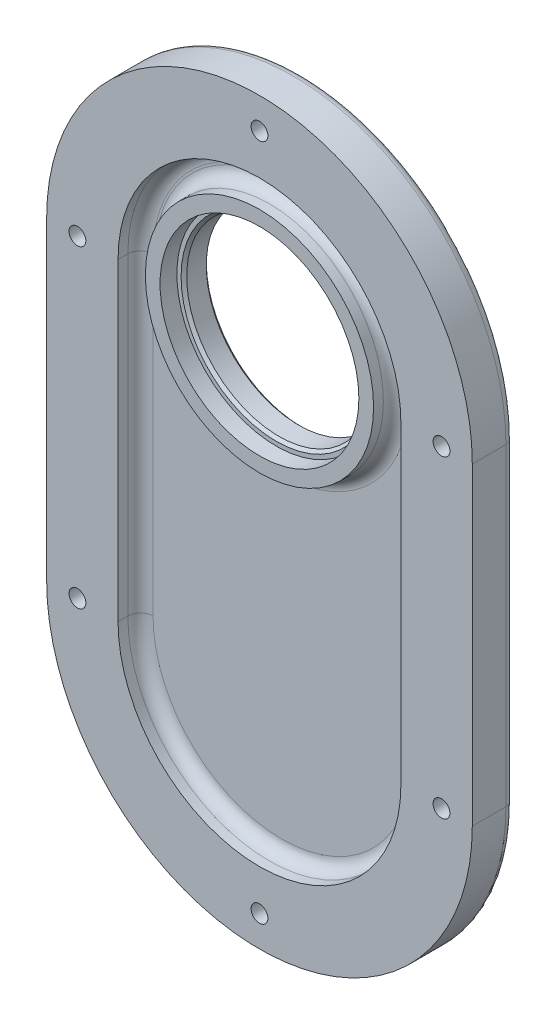
from build123d import *

# Parameters (mm, degrees)
EXTRUDE_1_DEPTH           = 15
SKETCH_2_R                = 40.75
CUT_EXTRUDE_1_DEPTH       = 8
SKETCH_3_R                = 35.5
CUT_EXTRUDE_2_DEPTH       = 6
SKETCH_4_R                = 33
CUT_EXTRUDE_3_DEPTH       = 203.98029461
CHAMFER_1_SIZE            = 1
FILLET_1_R                = 4.5
FILLET_2_R                = 3
HOLE_WIZARD_1_OUTLINE_R   = 7
HOLE_WIZARD_1_DEPTH       = 10
HOLE_START                = 10
HOLE_WIZARD_1_2_OUTLINE_R = 3
HOLE_WIZARD_1_2_DEPTH     = 5


# Read off the part's stored shape, not the designer's step: 孔1
with BuildPart() as part:
    # 草图1 → 凸台-拉伸1 (new body)
    with BuildSketch(Plane.XY):
        with BuildLine():
            Line((76, 0), (76, -112))
            ThreePointArc((76, -112), (0, -188), (-76, -112))
            Line((-76, -112), (-76, 0))
            ThreePointArc((-76, 0), (0, 76), (76, 0))
        make_face()
    extrude(amount=EXTRUDE_1_DEPTH)

    # 草图2 → 切除-拉伸1 (cut)
    with BuildSketch(Plane.XY.offset(15)):
        with BuildLine():
            Line((50.5, 0), (50.5, -112))
            ThreePointArc((50.5, -112), (0, -162.5), (-50.5, -112))
            Line((-50.5, -112), (-50.5, 0))
            ThreePointArc((-50.5, 0), (0, 50.5), (50.5, 0))
        make_face()
        Circle(SKETCH_2_R, mode=Mode.SUBTRACT)
    extrude(amount=-CUT_EXTRUDE_1_DEPTH, mode=Mode.SUBTRACT)

    # 草图3 → 切除-拉伸2 (cut)
    with BuildSketch(Plane.XY.offset(15)):
        Circle(SKETCH_3_R)
    extrude(amount=-CUT_EXTRUDE_2_DEPTH, mode=Mode.SUBTRACT)

    # 草图4 → 切除-拉伸3 (cut, through all)
    with BuildSketch(Plane.XY.offset(9)):
        Circle(SKETCH_4_R)
    extrude(amount=-CUT_EXTRUDE_3_DEPTH, mode=Mode.SUBTRACT)

    # 倒角1
    chamfer_1_edges = [part.edges().sort_by_distance(p)[0] for p in [
        (-33, 0, 0),
        (-33, 0, 9),
    ]]
    chamfer(chamfer_1_edges, length=CHAMFER_1_SIZE)

    # 圆角1
    fillet_1_edges = [part.edges().sort_by_distance(p)[0] for p in [
        (0, 50.5, 7),
        (50.5, -56, 7),
        (0, -162.5, 7),
        (-50.5, -56, 7),
        (-40.75, 0, 7),
    ]]
    fillet(fillet_1_edges, radius=FILLET_1_R)

    # 圆角2
    fillet_2_edges = [part.edges().sort_by_distance(p)[0] for p in [
        (76, -56, 0),
        (0, -188, 0),
        (-76, -56, 0),
        (0, 76, 0),
    ]]
    fillet(fillet_2_edges, radius=FILLET_2_R)

    # 孔1 outline → 孔1 (cut)
    with BuildSketch(Plane.XY):
        with Locations((0, 65)):
            Circle(HOLE_WIZARD_1_OUTLINE_R)
        with Locations((0, -177)):
            Circle(HOLE_WIZARD_1_OUTLINE_R)
        with Locations((-65, -112)):
            Circle(HOLE_WIZARD_1_OUTLINE_R)
        with Locations((-65, 0)):
            Circle(HOLE_WIZARD_1_OUTLINE_R)
        with Locations((65, -112)):
            Circle(HOLE_WIZARD_1_OUTLINE_R)
        with Locations((65, 0)):
            Circle(HOLE_WIZARD_1_OUTLINE_R)
    extrude(amount=HOLE_WIZARD_1_DEPTH, mode=Mode.SUBTRACT)

    # Hole Wizard 1 2 outline → Hole Wizard 1 2 (cut)
    with BuildSketch(Plane.XY.offset(HOLE_START)):
        with Locations((0, 65)):
            Circle(HOLE_WIZARD_1_2_OUTLINE_R)
        with Locations((0, -177)):
            Circle(HOLE_WIZARD_1_2_OUTLINE_R)
        with Locations((-65, -112)):
            Circle(HOLE_WIZARD_1_2_OUTLINE_R)
        with Locations((-65, 0)):
            Circle(HOLE_WIZARD_1_2_OUTLINE_R)
        with Locations((65, -112)):
            Circle(HOLE_WIZARD_1_2_OUTLINE_R)
        with Locations((65, 0)):
            Circle(HOLE_WIZARD_1_2_OUTLINE_R)
    extrude(amount=HOLE_WIZARD_1_2_DEPTH, mode=Mode.SUBTRACT)


solid = part.part
